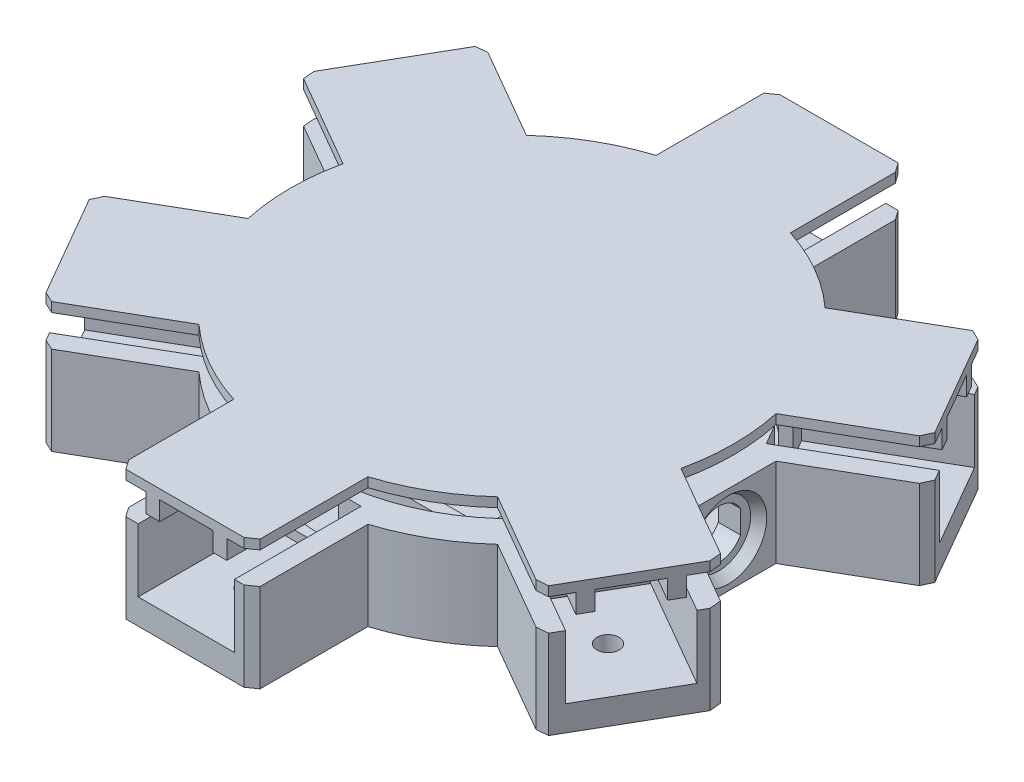
from build123d import *
from OCP.BRepFilletAPI import BRepFilletAPI_MakeChamfer

# Parameters (mm, degrees)
EXTRUDE_1_DEPTH     = 12
EXTRUDE_START       = 2
EXTRUDE_2_DEPTH     = 2
SKETCH_3_W          = 15.199999999999989
SKETCH_3_H          = 19.99999999999999
SKETCH_3_R          = 1.7500000000000004
SKETCH_3_R_2        = 1.7500000000005023
SKETCH_3_R_3        = 1.7500000000022933
SKETCH_3_R_4        = 1.7500000000036793
SKETCH_3_R_5        = 1.7500000000033842
SKETCH_3_R_6        = 1.7500000000018003
EXTRUDE_3_DEPTH     = 2
SKETCH_4_W          = 8
SKETCH_4_H          = 3.321565507275732
CUT_EXTRUDE_1_DEPTH = 8.5
CUT_EXTRUDE_2_DEPTH = 5
SKETCH_7_R          = 5
CUT_EXTRUDE_3_DEPTH = 1.5
CHAMFER_1_SIZE2     = 1.5
CHAMFER_1_SIZE      = 1.050311307
SKETCH_8_R          = 6.250000000000001
CUT_EXTRUDE_4_DEPTH = 5
SKETCH_6_W          = 30.000000000000018
SKETCH_6_H          = 39.00000000000001
EXTRUDE_4_DEPTH     = 5
EXTRUDE_5_DEPTH     = 3.5
CHAMFER_2_SIZE      = 1.5
CHAMFER_2_SIZE2     = 1.0503113073145682
SKETCH_10_R         = 1.7500000000000036
SKETCH_10_R_2       = 1.7500000000006353
SKETCH_10_R_3       = 1.750000000002967
SKETCH_10_R_4       = 1.750000000004767
SKETCH_10_R_5       = 1.7500000000043445
SKETCH_10_R_6       = 1.7500000000022113
CUT_EXTRUDE_5_DEPTH = 73.62872211301196
CHAMFER_3_SIZE      = 1.5
CHAMFER_3_SIZE2     = 1.0503113073145682
CHAMFER_3_SIZE2_2   = 1.0503113073145676
CHAMFER_3_SIZE2_3   = 1.050311307314569
CHAMFER_3_SIZE2_4   = 1.0503113073145678
CHAMFER_3_SIZE2_5   = 1.0503113073145673
CHAMFER_3_SIZE2_6   = 1.050311307314568
EXTRUDE_6_DEPTH     = 3
EXTRUDE_6_2_DEPTH   = 3
EXTRUDE_6_3_DEPTH   = 3
EXTRUDE_6_4_DEPTH   = 3
EXTRUDE_6_5_DEPTH   = 3
EXTRUDE_6_6_DEPTH   = 3
EXTRUDE_6_7_DEPTH   = 3
EXTRUDE_6_8_DEPTH   = 3
EXTRUDE_6_9_DEPTH   = 3
EXTRUDE_6_10_DEPTH  = 3
EXTRUDE_6_11_DEPTH  = 3
EXTRUDE_6_12_DEPTH  = 3
EXTRUDE_6_13_DEPTH  = 3
EXTRUDE_7_DEPTH     = 1.5


with BuildPart() as part:
    # Эскиз1 → Бобышка-Вытянуть1 (new body)
    with BuildSketch(Plane(origin=(0, 0, 0), x_dir=(1, 0, 0), z_dir=(0, 1, 0))):
        with BuildLine():
            Line((-7.599999999999993, 31.44), (-7.599999999999996, 51.44))
            Line((-7.599999999999996, 51.44), (-10.599999999999994, 51.44))
            Line((-10.599999999999994, 51.44), (-10.599999999999993, 33.35625878302303))
            ThreePointArc((-10.599999999999993, 33.35625878302303), (-17.499999999999947, 30.310889132455397), (-23.587367481305645, 25.857998671626635))
            Line((-23.587367481305645, 25.857998671626635), (-39.24834677067146, 34.8998692801151))
            Line((-39.24834677067146, 34.8998692801151), (-40.74834677067145, 32.30179306876178))
            Line((-40.74834677067145, 32.30179306876178), (-23.427838694982682, 22.3017930687618))
            Line((-23.427838694982682, 22.3017930687618), (-31.02783869498267, 9.138206931238326))
            Line((-31.02783869498267, 9.138206931238326), (-48.34834677067144, 19.138206931238315))
            Line((-48.34834677067144, 19.138206931238315), (-49.84834677067145, 16.540130719884996))
            Line((-49.84834677067145, 16.540130719884996), (-34.18736748130565, 7.498260111396523))
            ThreePointArc((-34.18736748130565, 7.498260111396523), (-34.99999999999993, 1.4417e-13), (-34.18736748130567, -7.49826011139625))
            Line((-34.18736748130567, -7.49826011139625), (-49.848346770671455, -16.540130719884772))
            Line((-49.848346770671455, -16.540130719884772), (-48.34834677067145, -19.138206931238084))
            Line((-48.34834677067145, -19.138206931238084), (-31.027838694982687, -9.138206931238079))
            Line((-31.027838694982687, -9.138206931238079), (-23.42783869498268, -22.301793068761537))
            Line((-23.42783869498268, -22.301793068761537), (-40.74834677067144, -32.301793068761555))
            Line((-40.74834677067144, -32.301793068761555), (-39.248346770671446, -34.89986928011487))
            Line((-39.248346770671446, -34.89986928011487), (-23.587367481305666, -25.85799867162636))
            ThreePointArc((-23.587367481305666, -25.85799867162636), (-17.49999999999999, -30.310889132455134), (-10.60000000000007, -33.35625878302277))
            Line((-10.60000000000007, -33.35625878302277), (-10.60000000000005, -51.439999999999756))
            Line((-10.60000000000005, -51.439999999999756), (-7.6000000000000485, -51.439999999999756))
            Line((-7.6000000000000485, -51.439999999999756), (-7.600000000000051, -31.43999999999976))
            Line((-7.600000000000051, -31.43999999999976), (7.599999999999947, -31.43999999999976))
            Line((7.599999999999947, -31.43999999999976), (7.59999999999995, -51.439999999999756))
            Line((7.59999999999995, -51.439999999999756), (10.59999999999995, -51.439999999999756))
            Line((10.59999999999995, -51.439999999999756), (10.599999999999941, -33.35625878302278))
            ThreePointArc((10.599999999999941, -33.35625878302278), (17.499999999999876, -30.310889132455145), (23.58736748130558, -25.85799867162641))
            Line((23.58736748130558, -25.85799867162641), (39.24834677067138, -34.899869280114885))
            Line((39.24834677067138, -34.899869280114885), (40.74834677067138, -32.30179306876157))
            Line((40.74834677067138, -32.30179306876157), (23.427838694982615, -22.30179306876157))
            Line((23.427838694982615, -22.30179306876157), (31.027838694982613, -9.138206931238104))
            Line((31.027838694982613, -9.138206931238104), (48.348346770671384, -19.138206931238102))
            Line((48.348346770671384, -19.138206931238102), (49.848346770671384, -16.540130719884782))
            Line((49.848346770671384, -16.540130719884782), (34.18736748130559, -7.498260111396299))
            Line((34.18736748130559, -7.498260111396299), (34.187367481305614, 7.498260111396479))
            Line((34.187367481305614, 7.498260111396479), (49.848346770671405, 16.540130719884996))
            Line((49.848346770671405, 16.540130719884996), (48.34834677067141, 19.13820693123831))
            Line((48.34834677067141, 19.13820693123831), (31.027838694982638, 9.138206931238308))
            Line((31.027838694982638, 9.138206931238308), (23.427838694982633, 22.301793068761775))
            Line((23.427838694982633, 22.301793068761775), (40.748346770671404, 32.301793068761775))
            Line((40.748346770671404, 32.301793068761775), (39.248346770671404, 34.89986928011509))
            Line((39.248346770671404, 34.89986928011509), (23.587367481305627, 25.857998671626596))
            ThreePointArc((23.587367481305627, 25.857998671626596), (17.499999999999936, 30.31088913245534), (10.600000000000003, 33.35625878302302))
            Line((10.600000000000003, 33.35625878302302), (10.600000000000001, 51.44))
            Line((10.600000000000001, 51.44), (7.600000000000002, 51.44))
            Line((7.600000000000002, 51.44), (7.599999999999993, 31.44))
            Line((7.599999999999993, 31.44), (-7.599999999999993, 31.44))
        make_face()
        with BuildLine():
            Line((29.18736748130573, 6.935241849511566), (29.18736748130574, -6.935241849511548))
            ThreePointArc((29.18736748130574, -6.935241849511548), (-29.999999999999996, -9.65e-15), (29.18736748130573, 6.935241849511566))
        make_face(mode=Mode.SUBTRACT)
    extrude(amount=EXTRUDE_1_DEPTH)

    # Эскиз2 → Бобышка-Вытянуть2 (add)
    with BuildSketch(Plane.XZ.offset(EXTRUDE_START)):
        with BuildLine():
            Line((-10.60000000000005, 51.439999999999756), (10.59999999999995, 51.439999999999756))
            Line((10.59999999999995, 51.439999999999756), (10.599999999999941, 33.35625878302278))
            ThreePointArc((10.599999999999941, 33.35625878302278), (17.499999999999883, 30.31088913245516), (23.58736748130557, 25.8579986716264))
            Line((23.58736748130557, 25.8579986716264), (39.24834677067138, 34.899869280114885))
            Line((39.24834677067138, 34.899869280114885), (49.848346770671384, 16.540130719884782))
            Line((49.848346770671384, 16.540130719884782), (34.18736748130559, 7.498260111396299))
            Line((34.18736748130559, 7.498260111396299), (34.187367481305614, -7.498260111396479))
            Line((34.187367481305614, -7.498260111396479), (49.848346770671405, -16.540130719884996))
            Line((49.848346770671405, -16.540130719884996), (39.248346770671404, -34.89986928011509))
            Line((39.248346770671404, -34.89986928011509), (23.587367481305627, -25.857998671626596))
            ThreePointArc((23.587367481305627, -25.857998671626596), (17.499999999999947, -30.310889132455358), (10.600000000000001, -33.356258783022994))
            Line((10.600000000000001, -33.356258783022994), (10.600000000000001, -51.44))
            Line((10.600000000000001, -51.44), (-10.599999999999994, -51.44))
            Line((-10.599999999999994, -51.44), (-10.599999999999993, -33.35625878302303))
            ThreePointArc((-10.599999999999993, -33.35625878302303), (-17.49999999999994, -30.310889132455387), (-23.587367481305638, -25.857998671626646))
            Line((-23.587367481305638, -25.857998671626646), (-39.24834677067146, -34.8998692801151))
            Line((-39.24834677067146, -34.8998692801151), (-48.34834677067144, -19.138206931238315))
            Line((-48.34834677067144, -19.138206931238315), (-49.84834677067145, -16.540130719884996))
            Line((-49.84834677067145, -16.540130719884996), (-34.18736748130565, -7.498260111396523))
            ThreePointArc((-34.18736748130565, -7.498260111396523), (-34.99999999999991, -1.356e-13), (-34.187367481305685, 7.498260111396258))
            Line((-34.187367481305685, 7.498260111396258), (-49.848346770671455, 16.540130719884772))
            Line((-49.848346770671455, 16.540130719884772), (-39.248346770671446, 34.89986928011487))
            Line((-39.248346770671446, 34.89986928011487), (-23.587367481305666, 25.85799867162636))
            ThreePointArc((-23.587367481305666, 25.85799867162636), (-17.50000000000001, 30.310889132455106), (-10.6000000000001, 33.35625878302277))
            Line((-10.6000000000001, 33.35625878302277), (-10.60000000000005, 51.439999999999756))
        make_face()
    extrude(amount=-EXTRUDE_2_DEPTH)

    # Эскиз3 → Бобышка-Вытянуть3 (add)
    # profile 1 of 6: a face of its own
    with BuildSketch(Plane(origin=(0, 0, 0), x_dir=(1, 0, 0), z_dir=(0, 1, 0))):
        with Locations((-2.22e-15, 41.44)):
            Rectangle(SKETCH_3_W, SKETCH_3_H)
        with Locations(Location((-1.73e-15, 41.440000000000005, 0), (0, 0, 270))):
            Circle(SKETCH_3_R, mode=Mode.SUBTRACT)
    # profile 2 of 6: a face of its own
    with BuildSketch(Plane(origin=(0, 0, 0), x_dir=(1, 0, 0), z_dir=(0, 1, 0))):
        Polygon((40.74834677067241, 32.301793068763274), (48.34834677067242, 19.13820693123983), (31.02783869498364, 9.138206931239816), (23.427838694983645, 22.30179306876327), align=None)
        with Locations(Location((35.88809273282802, 20.72000000000155, 0), (0, 0, 270))):
            Circle(SKETCH_3_R_2, mode=Mode.SUBTRACT)
    # profile 3 of 6: a face of its own
    with BuildSketch(Plane(origin=(0, 0, 0), x_dir=(1, 0, 0), z_dir=(0, 1, 0))):
        Polygon((48.34834677067419, -19.13820693123672), (40.74834677067421, -32.30179306876019), (23.427838694985432, -22.301793068760183), (31.027838694985423, -9.138206931236725), align=None)
        with Locations(Location((35.88809273282982, -20.719999999998457, 0), (0, 0, 270))):
            Circle(SKETCH_3_R_3, mode=Mode.SUBTRACT)
    # profile 4 of 6: a face of its own
    with BuildSketch(Plane(origin=(0, 0, 0), x_dir=(1, 0, 0), z_dir=(0, 1, 0))):
        Polygon((7.600000000003557, -51.44), (-7.599999999996428, -51.44000000000001), (-7.5999999999964345, -31.44), (7.600000000003551, -31.44), align=None)
        with Locations(Location((3.56008e-12, -41.440000000000005, 0), (0, 0, 270))):
            Circle(SKETCH_3_R_4, mode=Mode.SUBTRACT)
    # profile 5 of 6: a face of its own
    with BuildSketch(Plane(origin=(0, 0, 0), x_dir=(1, 0, 0), z_dir=(0, 1, 0))):
        Polygon((-40.74834677066884, -32.301793068763295), (-48.34834677066885, -19.13820693123985), (-31.02783869498008, -9.138206931239829), (-23.42783869498008, -22.30179306876328), align=None)
        with Locations(Location((-35.88809273282446, -20.720000000001555, 0), (0, 0, 270))):
            Circle(SKETCH_3_R_5, mode=Mode.SUBTRACT)
    # profile 6 of 6: a face of its own
    with BuildSketch(Plane(origin=(0, 0, 0), x_dir=(1, 0, 0), z_dir=(0, 1, 0))):
        Polygon((-48.348346770670645, 19.138206931236688), (-40.74834677067068, 32.30179306876016), (-23.427838694981887, 22.30179306876017), (-31.027838694981867, 9.138206931236708), align=None)
        with Locations(Location((-35.888092732826266, 20.719999999998436, 0), (0, 0, 270))):
            Circle(SKETCH_3_R_6, mode=Mode.SUBTRACT)
    extrude(amount=EXTRUDE_3_DEPTH)

    # Эскиз4 → Вырез-Вытянуть1 (cut)
    with BuildSketch(Plane(origin=(0, 12, 0), x_dir=(1, 0, 0), z_dir=(0, 1, 0))):
        Polygon((25.60639352508, 19.40266034819837), (29.606393525080005, 12.474457117922865), (26.729833415445075, 10.813674364285001), (22.72983341544507, 17.74187759456051), align=None)
        with Locations((0, 30.216334712480567)):
            Rectangle(SKETCH_4_W, SKETCH_4_H)
        Polygon((29.606393525081625, -12.474457117920053), (25.60639352508163, -19.402660348195564), (22.7298334154467, -17.7418775945577), (26.729833415446695, -10.81367436428219), align=None)
        Polygon((4.000000000003237, -31.87711746611843), (-3.999999999996763, -31.87711746611843), (-3.999999999996764, -28.555551958842702), (4.0000000000032365, -28.555551958842702), align=None)
        Polygon((-25.60639352507676, -19.40266034819838), (-29.606393525076765, -12.474457117922876), (-26.72983341544184, -10.813674364285008), (-22.729833415441835, -17.741877594560513), align=None)
        Polygon((-29.6063935250784, 12.474457117920036), (-25.606393525078403, 19.40266034819555), (-22.729833415443473, 17.74187759455769), (-26.72983341544347, 10.813674364282175), align=None)
    extrude(amount=-CUT_EXTRUDE_1_DEPTH, mode=Mode.SUBTRACT)

    # Эскиз5 → Вырез-Вытянуть2 (cut)
    with BuildSketch(Plane(origin=(34.1873674813056, 0, 4.746e-14), x_dir=(1.39e-15, 0, -1), z_dir=(1, 0, 1.39e-15))):
        with BuildLine():
            Line((-3.4, 6.806239186818845), (-3.3999999999999986, 3.1937608131811546))
            ThreePointArc((-3.3999999999999986, 3.1937608131811546), (7.316e-14, 1.1499999999998796), (3.4000000000000004, 3.1937608131811555))
            Line((3.4000000000000004, 3.1937608131811555), (3.4, 6.806239186818847))
            ThreePointArc((3.4, 6.806239186818847), (7.145e-14, 8.84999999999988), (-3.4, 6.806239186818845))
        make_face()
    extrude(amount=-CUT_EXTRUDE_2_DEPTH, mode=Mode.SUBTRACT)

    # Эскиз7 → Вырез-Вытянуть3 (cut)
    with BuildSketch(Plane(origin=(34.1873674813056, 0, 4.746e-14), x_dir=(1.39e-15, 0, -1), z_dir=(1, 0, 1.39e-15))):
        with Locations((1.3704e-13, 5)):
            Circle(SKETCH_7_R)
    extrude(amount=-CUT_EXTRUDE_3_DEPTH, mode=Mode.SUBTRACT)

    # Фаска1
    chamfer_1_edges = [part.edges().sort_by_distance(p)[0] for p in [
        (34.18736748130559, 5.000000000000001, 4.99999999999991),
    ]]
    chamfer_1_side = [part.faces().sort_by_distance(p)[0] for p in [
        (34.18736748130559, 5.000000000000001, 5.021006226146202),
    ]]
    chamfer(chamfer_1_edges, length=CHAMFER_1_SIZE - 0.0001, length2=CHAMFER_1_SIZE2 - 0.0001, reference=chamfer_1_side[0])  # a hair under: the kernel refuses the full size

    # Эскиз8 → Вырез-Вытянуть4 (cut)
    with BuildSketch(Plane.ZY.offset(-29.187367481305735)):
        with Locations((-7.532e-14, 5)):
            Circle(SKETCH_8_R)
    extrude(amount=CUT_EXTRUDE_4_DEPTH, mode=Mode.SUBTRACT)

    # Эскиз6 → Бобышка-Вытянуть4 (add)
    with BuildSketch(Plane(origin=(0, 0, 0), x_dir=(1, 0, 0), z_dir=(0, 1, 0))):
        Rectangle(SKETCH_6_W, SKETCH_6_H)
        Polygon((-13.000000000000002, 17.5), (12.999999999999995, 17.5), (13.000000000000002, -17.5), (-13.000000000000002, -17.5), align=None, mode=Mode.SUBTRACT)
    extrude(amount=EXTRUDE_4_DEPTH)

    # Эскиз9 → Бобышка-Вытянуть5 (add)
    with BuildSketch(Plane(origin=(0, 0, 0), x_dir=(1, 0, 0), z_dir=(0, 1, 0))):
        Polygon((-13.000000000000002, 17.5), (-11.600000000000001, 17.5), (-11.599999999999998, -16.1), (11.599999999999998, -16.1), (11.599999999999994, 17.5), (12.999999999999995, 17.5), (12.999999999999995, -17.5), (11.6, -17.5), (-11.599999999999996, -17.5), (-13.000000000000002, -17.5), align=None)
    extrude(amount=EXTRUDE_5_DEPTH)

    # Фаска2: one chamfer whose edges measure the first distance from different faces: ONE call of the kernel's chamfer builder (chamfer() names one face for all edges)
    chamfer_2_edges_1 = [part.edges().sort_by_distance(p)[0] for p in [
        (12.999999999999995, 4.25, -17.5),
    ]]
    chamfer_2_side_1 = [part.faces().sort_by_distance(p)[0] for p in [
        (-4.05e-15, 2.5611480865224623, -17.5),
    ]]
    chamfer_2_edges_2 = [part.edges().sort_by_distance(p)[0] for p in [
        (-13.000000000000002, 4.25, -17.5),
    ]]
    chamfer_2_side_2 = [part.faces().sort_by_distance(p)[0] for p in [
        (-13.000000000000002, 4.25, 6.7e-16),
    ]]
    chamfer_2 = BRepFilletAPI_MakeChamfer(part.part.solid().wrapped)
    for e in chamfer_2_edges_1:
        chamfer_2.Add(CHAMFER_2_SIZE, CHAMFER_2_SIZE2, e.wrapped, chamfer_2_side_1[0].wrapped)  # the first distance lies on this face
    for e in chamfer_2_edges_2:
        chamfer_2.Add(CHAMFER_2_SIZE, CHAMFER_2_SIZE2, e.wrapped, chamfer_2_side_2[0].wrapped)  # the first distance lies on this face
    add(Compound.cast(chamfer_2.Shape()), mode=Mode.REPLACE)

    # Эскиз10 → Вырез-Вытянуть5 (cut, through all)
    with BuildSketch(Plane(origin=(0, 0, 0), x_dir=(1, 0, 0), z_dir=(0, 1, 0))):
        with Locations(Location((-1.73e-15, 41.440000000000005, 0), (0, 0, 270))):
            Circle(SKETCH_10_R)
        with Locations(Location((35.8880927328283, 20.72000000000204, 0), (0, 0, 270))):
            Circle(SKETCH_10_R_2)
        with Locations(Location((35.88809273283067, -20.719999999997967, 0), (0, 0, 270))):
            Circle(SKETCH_10_R_3)
        with Locations(Location((4.69422e-12, -41.440000000000005, 0), (0, 0, 270))):
            Circle(SKETCH_10_R_4)
        with Locations(Location((-35.88809273282361, -20.72000000000205, 0), (0, 0, 270))):
            Circle(SKETCH_10_R_5)
        with Locations(Location((-35.88809273282598, 20.719999999997942, 0), (0, 0, 270))):
            Circle(SKETCH_10_R_6)
    extrude(amount=-CUT_EXTRUDE_5_DEPTH, mode=Mode.SUBTRACT)

    # Фаска3: one chamfer whose edges measure the first distance from different faces: ONE call of the kernel's chamfer builder (chamfer() names one face for all edges)
    chamfer_3_edges_1 = [part.edges().sort_by_distance(p)[0] for p in [
        (10.600000000000001, 5, -51.44),
    ]]
    chamfer_3_side_1 = [part.faces().sort_by_distance(p)[0] for p in [
        (10.600000000000001, 4.999999999999998, -42.3981293915115),
    ]]
    chamfer_3_edges_2 = [part.edges().sort_by_distance(p)[0] for p in [
        (39.248346770671404, 5, -34.89986928011509),
    ]]
    chamfer_3_side_2 = [part.faces().sort_by_distance(p)[0] for p in [
        (40.6213192146058, 7, -32.5218112498287),
    ]]
    chamfer_3_edges_3 = [part.edges().sort_by_distance(p)[0] for p in [
        (49.848346770671405, 5, -16.540130719884996),
    ]]
    chamfer_3_side_3 = [part.faces().sort_by_distance(p)[0] for p in [
        (42.017857125988506, 5, -12.019195415640738),
    ]]
    chamfer_3_edges_4 = [part.edges().sort_by_distance(p)[0] for p in [
        (49.848346770671384, 5, 16.540130719884782),
    ]]
    chamfer_3_side_4 = [part.faces().sort_by_distance(p)[0] for p in [
        (39.99834677067138, 11.745944887868793, 33.60083117443823),
    ]]
    chamfer_3_edges_5 = [part.edges().sort_by_distance(p)[0] for p in [
        (39.24834677067138, 5, 34.899869280114885),
    ]]
    chamfer_3_side_5 = [part.faces().sort_by_distance(p)[0] for p in [
        (31.417857125988476, 4.999999999999999, 30.37893397587065),
    ]]
    chamfer_3_edges_6 = [part.edges().sort_by_distance(p)[0] for p in [
        (10.59999999999995, 5, 51.439999999999756),
    ]]
    chamfer_3_side_6 = [part.faces().sort_by_distance(p)[0] for p in [
        (-9.10000000000005, 11.745944887868793, 51.439999999999756),
    ]]
    chamfer_3_edges_7 = [part.edges().sort_by_distance(p)[0] for p in [
        (-10.60000000000005, 5, 51.439999999999756),
    ]]
    chamfer_3_side_7 = [part.faces().sort_by_distance(p)[0] for p in [
        (-10.60000000000006, 5.000000000000001, 42.39812939151126),
    ]]
    chamfer_3_edges_8 = [part.edges().sort_by_distance(p)[0] for p in [
        (-39.248346770671446, 5, 34.89986928011487),
    ]]
    chamfer_3_side_8 = [part.faces().sort_by_distance(p)[0] for p in [
        (-49.09834677067145, 11.745944887868793, 17.83916882556143),
    ]]
    chamfer_3_edges_9 = [part.edges().sort_by_distance(p)[0] for p in [
        (-49.848346770671455, 5, 16.540130719884772),
    ]]
    chamfer_3_side_9 = [part.faces().sort_by_distance(p)[0] for p in [
        (-42.01785712598857, 5.000000000000002, 12.019195415640514),
    ]]
    chamfer_3_edges_10 = [part.edges().sort_by_distance(p)[0] for p in [
        (-49.84834677067145, 5, -16.540130719884996),
    ]]
    chamfer_3_side_10 = [part.faces().sort_by_distance(p)[0] for p in [
        (-39.99834677067146, 11.745944887868793, -33.60083117443844),
    ]]
    chamfer_3_edges_11 = [part.edges().sort_by_distance(p)[0] for p in [
        (-39.24834677067146, 5, -34.8998692801151),
    ]]
    chamfer_3_side_11 = [part.faces().sort_by_distance(p)[0] for p in [
        (-31.41785712598855, 5, -30.37893397587087),
    ]]
    chamfer_3_edges_12 = [part.edges().sort_by_distance(p)[0] for p in [
        (-10.599999999999994, 5, -51.44),
    ]]
    chamfer_3_side_12 = [part.faces().sort_by_distance(p)[0] for p in [
        (9.100000000000001, 11.745944887868793, -51.44),
    ]]
    chamfer_3 = BRepFilletAPI_MakeChamfer(part.part.solid().wrapped)
    for e in chamfer_3_edges_1:
        chamfer_3.Add(CHAMFER_3_SIZE, CHAMFER_3_SIZE2, e.wrapped, chamfer_3_side_1[0].wrapped)  # the first distance lies on this face
    for e in chamfer_3_edges_2:
        chamfer_3.Add(CHAMFER_3_SIZE, CHAMFER_3_SIZE2_2, e.wrapped, chamfer_3_side_2[0].wrapped)  # the first distance lies on this face
    for e in chamfer_3_edges_3:
        chamfer_3.Add(CHAMFER_3_SIZE, CHAMFER_3_SIZE2_3, e.wrapped, chamfer_3_side_3[0].wrapped)  # the first distance lies on this face
    for e in chamfer_3_edges_4:
        chamfer_3.Add(CHAMFER_3_SIZE, CHAMFER_3_SIZE2_4, e.wrapped, chamfer_3_side_4[0].wrapped)  # the first distance lies on this face
    for e in chamfer_3_edges_5:
        chamfer_3.Add(CHAMFER_3_SIZE, CHAMFER_3_SIZE2_3, e.wrapped, chamfer_3_side_5[0].wrapped)  # the first distance lies on this face
    for e in chamfer_3_edges_6:
        chamfer_3.Add(CHAMFER_3_SIZE, CHAMFER_3_SIZE2_4, e.wrapped, chamfer_3_side_6[0].wrapped)  # the first distance lies on this face
    for e in chamfer_3_edges_7:
        chamfer_3.Add(CHAMFER_3_SIZE, CHAMFER_3_SIZE2_3, e.wrapped, chamfer_3_side_7[0].wrapped)  # the first distance lies on this face
    for e in chamfer_3_edges_8:
        chamfer_3.Add(CHAMFER_3_SIZE, CHAMFER_3_SIZE2_3, e.wrapped, chamfer_3_side_8[0].wrapped)  # the first distance lies on this face
    for e in chamfer_3_edges_9:
        chamfer_3.Add(CHAMFER_3_SIZE, CHAMFER_3_SIZE2_5, e.wrapped, chamfer_3_side_9[0].wrapped)  # the first distance lies on this face
    for e in chamfer_3_edges_10:
        chamfer_3.Add(CHAMFER_3_SIZE, CHAMFER_3_SIZE2_3, e.wrapped, chamfer_3_side_10[0].wrapped)  # the first distance lies on this face
    for e in chamfer_3_edges_11:
        chamfer_3.Add(CHAMFER_3_SIZE, CHAMFER_3_SIZE2, e.wrapped, chamfer_3_side_11[0].wrapped)  # the first distance lies on this face
    for e in chamfer_3_edges_12:
        chamfer_3.Add(CHAMFER_3_SIZE, CHAMFER_3_SIZE2_6, e.wrapped, chamfer_3_side_12[0].wrapped)  # the first distance lies on this face
    add(Compound.cast(chamfer_3.Shape()), mode=Mode.REPLACE)


with BuildPart() as body_2:
    # Эскиз12 → Бобышка-Вытянуть6 (new body)
    with BuildSketch(Plane(origin=(0, 17, 0), x_dir=(1, 0, 0), z_dir=(0, 1, 0))):
        Polygon((-6.400000000000002, 51.44), (-4.200000000000002, 51.44), (-4.2, 32.44), (-6.3999999999999995, 32.44), align=None)
    extrude(amount=-EXTRUDE_6_DEPTH)



with BuildPart() as body_3:
    # Эскиз12 → Extrude 6 2 (new body)
    with BuildSketch(Plane(origin=(0, 17, 0), x_dir=(1, 0, 0), z_dir=(0, 1, 0))):
        Polygon((6.399999999999999, 51.44), (6.400000000000001, 32.44), (4.2, 32.44), (4.199999999999999, 51.44), align=None)
    extrude(amount=-EXTRUDE_6_2_DEPTH)


with BuildPart() as body_4:
    # Эскиз12 → Extrude 6 3 (new body)
    with BuildSketch(Plane(origin=(0, 17, 0), x_dir=(1, 0, 0), z_dir=(0, 1, 0))):
        Polygon((41.34834677067223, 31.262562584222067), (42.44834677067222, 29.357306695896302), (25.99386409876788, 19.8573066958963), (24.893864098767807, 21.76256258422219), align=None)
    extrude(amount=-EXTRUDE_6_3_DEPTH)


with BuildPart() as body_5:
    # Эскиз12 → Extrude 6 4 (new body)
    with BuildSketch(Plane(origin=(0, 17, 0), x_dir=(1, 0, 0), z_dir=(0, 1, 0))):
        Polygon((47.74834677067223, 20.177437415781256), (31.293864098767813, 10.677437415781375), (30.193864098767882, 12.582693304107009), (46.64834677067222, 22.082693304107018), align=None)
    extrude(amount=-EXTRUDE_6_4_DEPTH)


with BuildPart() as body_6:
    # Эскиз12 → Extrude 6 5 (new body)
    with BuildSketch(Plane(origin=(0, 17, 0), x_dir=(1, 0, 0), z_dir=(0, 1, 0))):
        Polygon((47.74834677067402, -20.177437415777714), (46.648346770674024, -22.082693304103476), (30.193864098769556, -12.582693304103405), (31.293864098769664, -10.677437415777455), align=None)
    extrude(amount=-EXTRUDE_6_5_DEPTH)


with BuildPart() as body_7:
    # Эскиз12 → Extrude 6 6 (new body)
    with BuildSketch(Plane(origin=(0, 17, 0), x_dir=(1, 0, 0), z_dir=(0, 1, 0))):
        Polygon((41.34834677067402, -31.262562584218536), (24.893864098769665, -21.76256258421827), (25.99386409876956, -19.857306695892692), (42.44834677067403, -29.357306695892767), align=None)
    extrude(amount=-EXTRUDE_6_6_DEPTH)


with BuildPart() as body_8:
    # Эскиз12 → Extrude 6 7 (new body)
    with BuildSketch(Plane(origin=(0, 17, 0), x_dir=(1, 0, 0), z_dir=(0, 1, 0))):
        Polygon((6.400000000003578, -51.43999999999957), (4.2000000000035795, -51.43999999999957), (4.200000000003574, -32.439999999999294), (6.400000000003702, -32.439999999999294), align=None)
    extrude(amount=-EXTRUDE_6_7_DEPTH)


with BuildPart() as body_9:
    # Эскиз12 → Extrude 6 8 (new body)
    with BuildSketch(Plane(origin=(0, 17, 0), x_dir=(1, 0, 0), z_dir=(0, 1, 0))):
        Polygon((-6.399999999996423, -51.43999999999957), (-6.399999999996298, -32.439999999999294), (-4.199999999996427, -32.439999999999294), (-4.199999999996422, -51.43999999999957), align=None)
    extrude(amount=-EXTRUDE_6_8_DEPTH)


with BuildPart() as body_10:
    # Эскиз12 → Extrude 6 9 (new body)
    with BuildSketch(Plane(origin=(0, 17, 0), x_dir=(1, 0, 0), z_dir=(0, 1, 0))):
        Polygon((-41.34834677066864, -31.26256258422165), (-42.448346770668635, -29.35730669589589), (-25.993864098764092, -19.857306695895748), (-24.8938640987641, -21.76256258422149), align=None)
    extrude(amount=-EXTRUDE_6_9_DEPTH)


with BuildPart() as body_11:
    # Эскиз12 → Extrude 6 10 (new body)
    with BuildSketch(Plane(origin=(0, 17, 0), x_dir=(1, 0, 0), z_dir=(0, 1, 0))):
        Polygon((-47.74834677066865, -20.177437415780844), (-31.293864098764107, -10.67743741578068), (-30.193864098764095, -12.582693304106465), (-46.648346770668645, -22.082693304106606), align=None)
    extrude(amount=-EXTRUDE_6_10_DEPTH)


with BuildPart() as body_12:
    # Эскиз12 → Extrude 6 11 (new body)
    with BuildSketch(Plane(origin=(0, 17, 0), x_dir=(1, 0, 0), z_dir=(0, 1, 0))):
        Polygon((-47.74834677067046, 20.17743741577811), (-46.648346770670464, 22.082693304103877), (-30.193864098766017, 12.58269330410383), (-31.293864098765965, 10.677437415778144), align=None)
    extrude(amount=-EXTRUDE_6_11_DEPTH)


with BuildPart() as body_13:
    # Эскиз12 → Extrude 6 12 (new body)
    with BuildSketch(Plane(origin=(0, 17, 0), x_dir=(1, 0, 0), z_dir=(0, 1, 0))):
        Polygon((-41.348346770670474, 31.262562584218937), (-24.89386409876598, 21.762562584218966), (-25.99386409876602, 19.857306695893115), (-42.44834677067047, 29.35730669589317), align=None)
    extrude(amount=-EXTRUDE_6_12_DEPTH)


with BuildPart() as body_14:
    # Эскиз12 → Extrude 6 13 (new body)
    with BuildSketch(Plane(origin=(0, 17, 0), x_dir=(1, 0, 0), z_dir=(0, 1, 0))):
        with BuildLine():
            Line((28.53804138243629, 8.404920823800406), (25.900071170614453, 7.627995369499529))
            ThreePointArc((25.900071170614453, 7.627995369499529), (-27.000000000000004, -5.6024e-13), (25.900071170614765, -7.627995369498445))
            Line((25.900071170614765, -7.627995369498445), (28.53804138243664, -8.40492082379921))
            ThreePointArc((28.53804138243664, -8.40492082379921), (-29.75, -6.173e-13), (28.53804138243629, 8.404920823800406))
        make_face()
    extrude(amount=-EXTRUDE_6_13_DEPTH)


with BuildPart() as body_2_1:
    add(body_2.part)

    add(body_3.part)  # Бобышка-Вытянуть7 merges body 3

    add(body_4.part)  # Бобышка-Вытянуть7 merges body 4

    add(body_5.part)  # Бобышка-Вытянуть7 merges body 5

    add(body_6.part)  # Бобышка-Вытянуть7 merges body 6

    add(body_7.part)  # Бобышка-Вытянуть7 merges body 7

    add(body_8.part)  # Бобышка-Вытянуть7 merges body 8

    add(body_9.part)  # Бобышка-Вытянуть7 merges body 9

    add(body_10.part)  # Бобышка-Вытянуть7 merges body 10

    add(body_11.part)  # Бобышка-Вытянуть7 merges body 11

    add(body_12.part)  # Бобышка-Вытянуть7 merges body 12

    add(body_13.part)  # Бобышка-Вытянуть7 merges body 13

    add(body_14.part)  # Бобышка-Вытянуть7 merges body 14
    # Эскиз11 → Бобышка-Вытянуть7 (add)
    with BuildSketch(Plane(origin=(0, 17, 0), x_dir=(1, 0, 0), z_dir=(0, 1, 0))):
        with BuildLine():
            Line((-10.599999999999994, 50.389688692685425), (-10.599999999999993, 33.35625878302303))
            ThreePointArc((-10.599999999999993, 33.35625878302303), (-17.499999999999826, 30.31088913245547), (-23.587367481305417, 25.857998671626817))
            Line((-23.587367481305417, 25.857998671626817), (-37.94930866499448, 34.149869280115496))
            Line((-37.94930866499448, 34.149869280115496), (-39.773502424328406, 33.990273006099066))
            Line((-39.773502424328406, 33.990273006099066), (-49.098346770671306, 17.839168825562204))
            Line((-49.098346770671306, 17.839168825562204), (-48.938750496654876, 16.01497506622823))
            Line((-48.938750496654876, 16.01497506622823), (-34.187367481305664, 7.498260111396862))
            ThreePointArc((-34.187367481305664, 7.498260111396862), (-35.00000000000002, 3.7732e-13), (-34.187367481305785, -7.498260111396126))
            Line((-34.187367481305785, -7.498260111396126), (-48.549308664995024, -15.790130719884502))
            Line((-48.549308664995024, -15.790130719884502), (-49.32319111701441, -17.449726993900928))
            Line((-49.32319111701441, -17.449726993900928), (-39.99834677067185, -33.60083117443799))
            Line((-39.99834677067185, -33.60083117443799), (-38.33875049665537, -34.3747136264574))
            Line((-38.33875049665537, -34.3747136264574), (-23.587367481305986, -25.857998671626333))
            ThreePointArc((-23.587367481305986, -25.857998671626333), (-17.500000000000252, -30.310889132455213), (-10.600000000000234, -33.35625878302293))
            Line((-10.600000000000234, -33.35625878302293), (-10.60000000000035, -49.93999999999995))
            Line((-10.60000000000035, -49.93999999999995), (-9.549688692685814, -51.43999999999994))
            Line((-9.549688692685814, -51.43999999999994), (9.099999999999607, -51.440000000000076))
            Line((9.099999999999607, -51.440000000000076), (10.60000000000008, -50.38968869268445))
            Line((10.60000000000008, -50.38968869268445), (10.59999999999976, -33.356258783023115))
            ThreePointArc((10.59999999999976, -33.356258783023115), (17.499999999999826, -30.31088913245548), (23.587367481305602, -25.85799867162666))
            Line((23.587367481305602, -25.85799867162666), (37.949308664994724, -34.14986928011523))
            Line((37.949308664994724, -34.14986928011523), (39.77350242432864, -33.9902730060988))
            Line((39.77350242432864, -33.9902730060988), (49.098346770671434, -17.83916882556187))
            Line((49.098346770671434, -17.83916882556187), (48.93875049665499, -16.014975066227898))
            Line((48.93875049665499, -16.014975066227898), (34.187367481305714, -7.49826011139663))
            ThreePointArc((34.187367481305714, -7.49826011139663), (35.000000000000014, -1.292e-13), (34.18736748130573, 7.498260111396368))
            Line((34.18736748130573, 7.498260111396368), (48.5493086649949, 15.790130719884843))
            Line((48.5493086649949, 15.790130719884843), (49.32319111701428, 17.449726993901276))
            Line((49.32319111701428, 17.449726993901276), (39.99834677067162, 33.60083117443827))
            Line((39.99834677067162, 33.60083117443827), (38.33875049665513, 34.37471362645767))
            Line((38.33875049665513, 34.37471362645767), (23.587367481305805, 25.857998671626504))
            ThreePointArc((23.587367481305805, 25.857998671626504), (17.500000000000043, 30.310889132455337), (10.600000000000001, 33.356258783022994))
            Line((10.600000000000001, 33.356258783022994), (10.600000000000001, 49.94000000000001))
            Line((10.600000000000001, 49.94000000000001), (9.549688692685455, 51.44))
            Line((9.549688692685455, 51.44), (-9.099999999999966, 51.44))
            Line((-9.099999999999966, 51.44), (-10.599999999999994, 50.389688692685425))
        make_face()
    extrude(amount=EXTRUDE_7_DEPTH)


solid = Compound([part.part, body_2_1.part])
